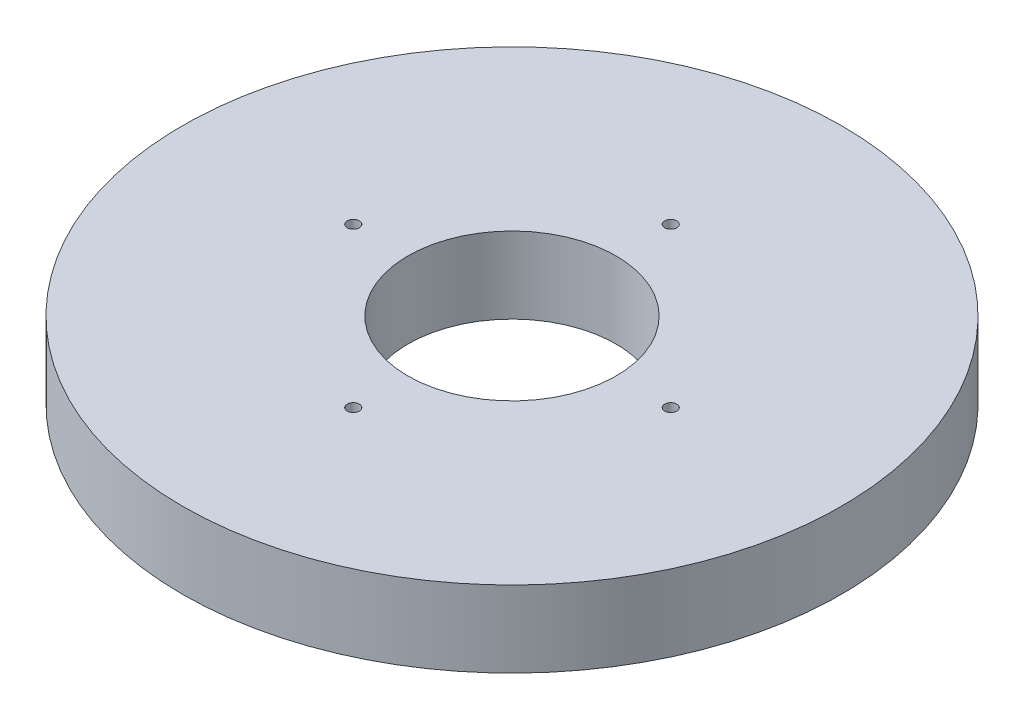
from build123d import *

# Parameters (mm, degrees)
SKETCH1_R           = 95
BOSS_EXTRUDE1_DEPTH = 22
SKETCH2_R           = 30
CUT_EXTRUDE1_DEPTH  = 137.1396342
SKETCH3_R           = 1.744340812
CUT_EXTRUDE2_DEPTH  = 21.751116263
CIRPATTERN1_COUNT   = 4


with BuildPart() as part:
    # Sketch1 → Boss-Extrude1 (new body)
    with BuildSketch(Plane(origin=(0, 0, 0), x_dir=(1, 0, 0), z_dir=(0, 1, 0))):
        Circle(SKETCH1_R)
    extrude(amount=BOSS_EXTRUDE1_DEPTH)

    # Sketch2 → Cut-Extrude1 (cut, through all)
    with BuildSketch(Plane(origin=(0, 0, 0), x_dir=(1, 0, 0), z_dir=(0, 1, 0))):
        Circle(SKETCH2_R)
    extrude(amount=CUT_EXTRUDE1_DEPTH, mode=Mode.SUBTRACT)

    # Sketch3 → Cut-Extrude2 (cut)
    with BuildSketch(Plane(origin=(0, 22, 0), x_dir=(1, 0, 0), z_dir=(0, 1, 0))):
        with Locations((-45.755327196, 0)):
            Circle(SKETCH3_R)
    cut_extrude2 = extrude(amount=-CUT_EXTRUDE2_DEPTH, mode=Mode.SUBTRACT)

    # CirPattern1: Cut-Extrude2 ×4 about axis
    cirpattern1_axis = Axis((0, 0, 0), (0, 1, 0))
    for i in range(1, CIRPATTERN1_COUNT):
        add(cut_extrude2.rotate(cirpattern1_axis, i * 360 / CIRPATTERN1_COUNT), mode=Mode.SUBTRACT)


solid = part.part
